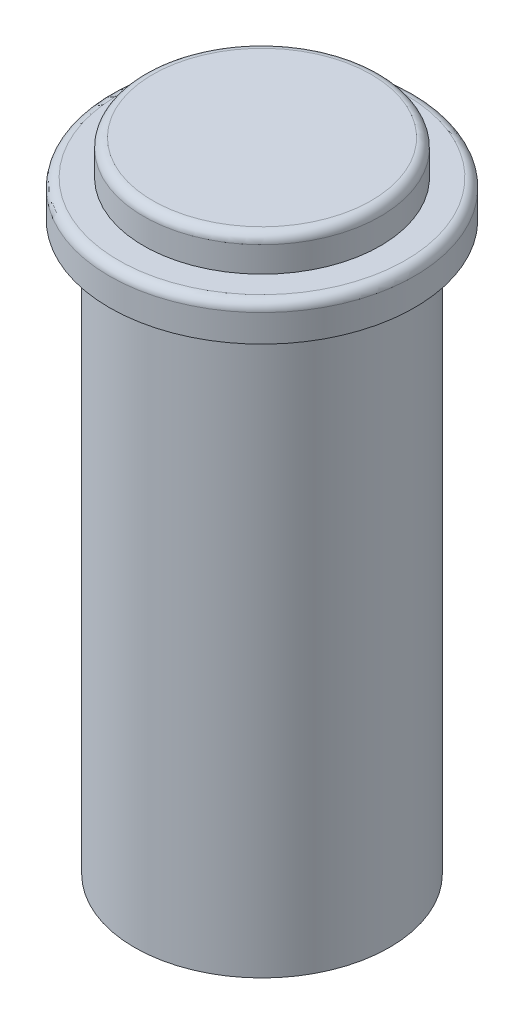
from build123d import *

# Parameters (mm, degrees)
FILLET1_R = 1


with BuildPart() as part:
    # Sketch1 → Revolve1 (revolve)
    with BuildSketch(Plane.XY):
        Polygon((0, 0), (-14, 0), (-14, 62.2), (-16.75, 62.2), (-16.75, 66.2), (-13, 66.2), (-13, 70), (0, 70), align=None)
    revolve(axis=Axis((0, 0, 0), (0, 1, 0)))

    # Fillet1
    fillet1_edges = [part.edges().sort_by_distance(p)[0] for p in [
        (13, 70, 0),
        (16.75, 66.2, 0),
    ]]
    fillet(fillet1_edges, radius=FILLET1_R)


solid = part.part
